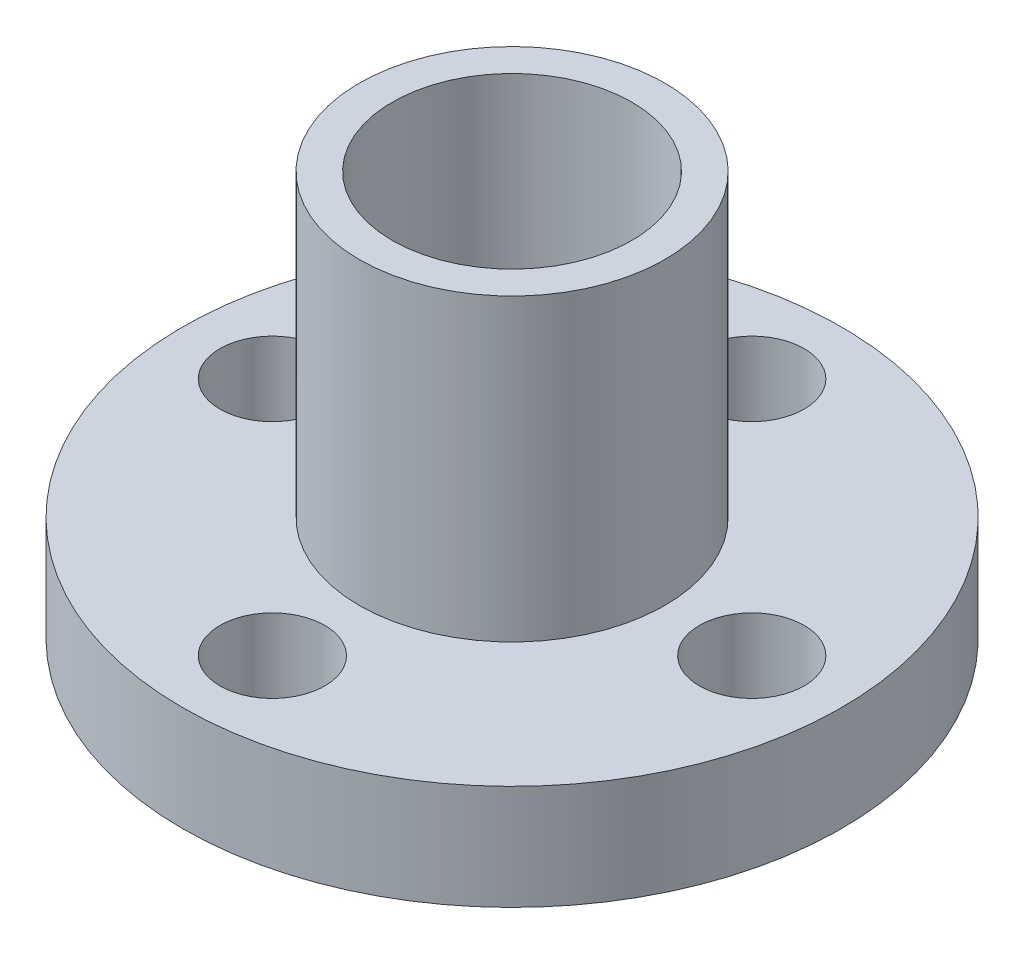
from build123d import *

# Parameters (mm, degrees)
SKETCH1_R           = 5.1
BOSS_EXTRUDE1_DEPTH = 1.5
SKETCH2_R           = 11
BOSS_EXTRUDE2_DEPTH = 3.5
SKETCH3_R           = 5.1
BOSS_EXTRUDE3_DEPTH = 10
SKETCH4_R           = 4
SKETCH4_R_2         = 1.75
CUT_EXTRUDE1_DEPTH  = 22.610182785


with BuildPart() as part:
    # Sketch1 → Boss-Extrude1 (new body)
    with BuildSketch(Plane(origin=(0, 0, 0), x_dir=(1, 0, 0), z_dir=(0, 1, 0))):
        Circle(SKETCH1_R)
    extrude(amount=BOSS_EXTRUDE1_DEPTH)

    # Sketch2 → Boss-Extrude2 (add)
    with BuildSketch(Plane(origin=(0, 1.5, 0), x_dir=(1, 0, 0), z_dir=(0, 1, 0))):
        Circle(SKETCH2_R)
    extrude(amount=BOSS_EXTRUDE2_DEPTH)

    # Sketch3 → Boss-Extrude3 (add)
    with BuildSketch(Plane(origin=(0, 5, 0), x_dir=(1, 0, 0), z_dir=(0, 1, 0))):
        Circle(SKETCH3_R)
    extrude(amount=BOSS_EXTRUDE3_DEPTH)

    # Sketch4 → Cut-Extrude1 (cut, through all)
    with BuildSketch(Plane(origin=(0, 15, 0), x_dir=(1, 0, 0), z_dir=(0, 1, 0))):
        Circle(SKETCH4_R)
        with Locations((8, 0)):
            Circle(SKETCH4_R_2)
        with Locations((0, 8)):
            Circle(SKETCH4_R_2)
        with Locations((-8, 0)):
            Circle(SKETCH4_R_2)
        with Locations((0, -8)):
            Circle(SKETCH4_R_2)
    extrude(amount=-CUT_EXTRUDE1_DEPTH, mode=Mode.SUBTRACT)


solid = part.part
